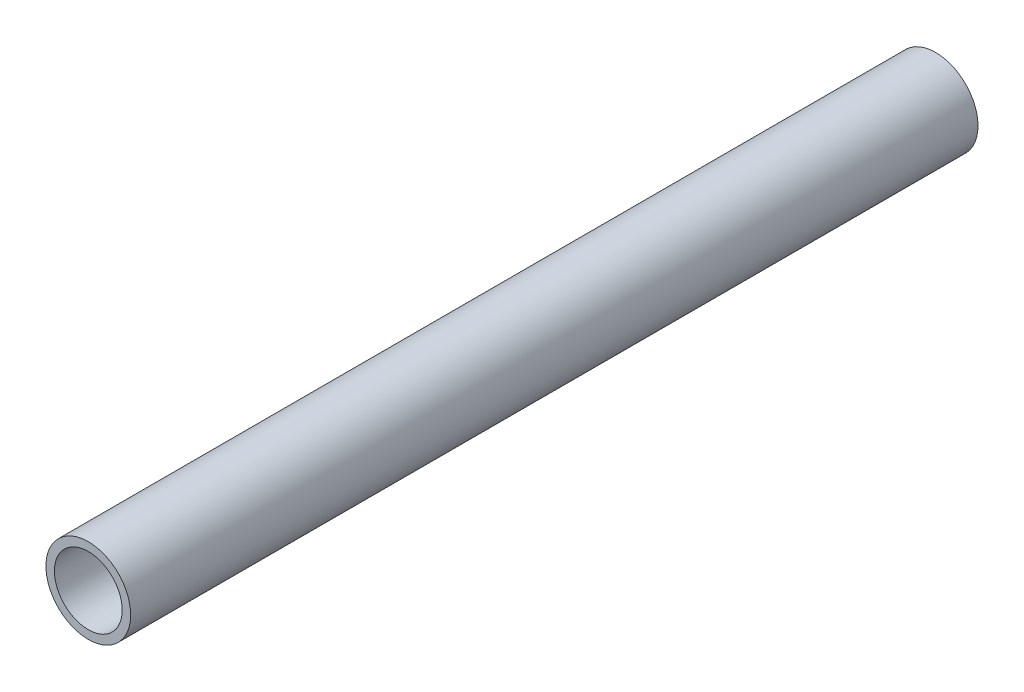
from build123d import *

# Parameters (mm, degrees)
PIPESKETCH_R    = 2.5
PIPESKETCH_R_2  = 2
EXTRUSION_DEPTH = 50


with BuildPart() as part:
    # PipeSketch → Extrusion (new body)
    with BuildSketch(Plane.XY):
        Circle(PIPESKETCH_R)
        Circle(PIPESKETCH_R_2, mode=Mode.SUBTRACT)
    extrude(amount=EXTRUSION_DEPTH)


solid = part.part
